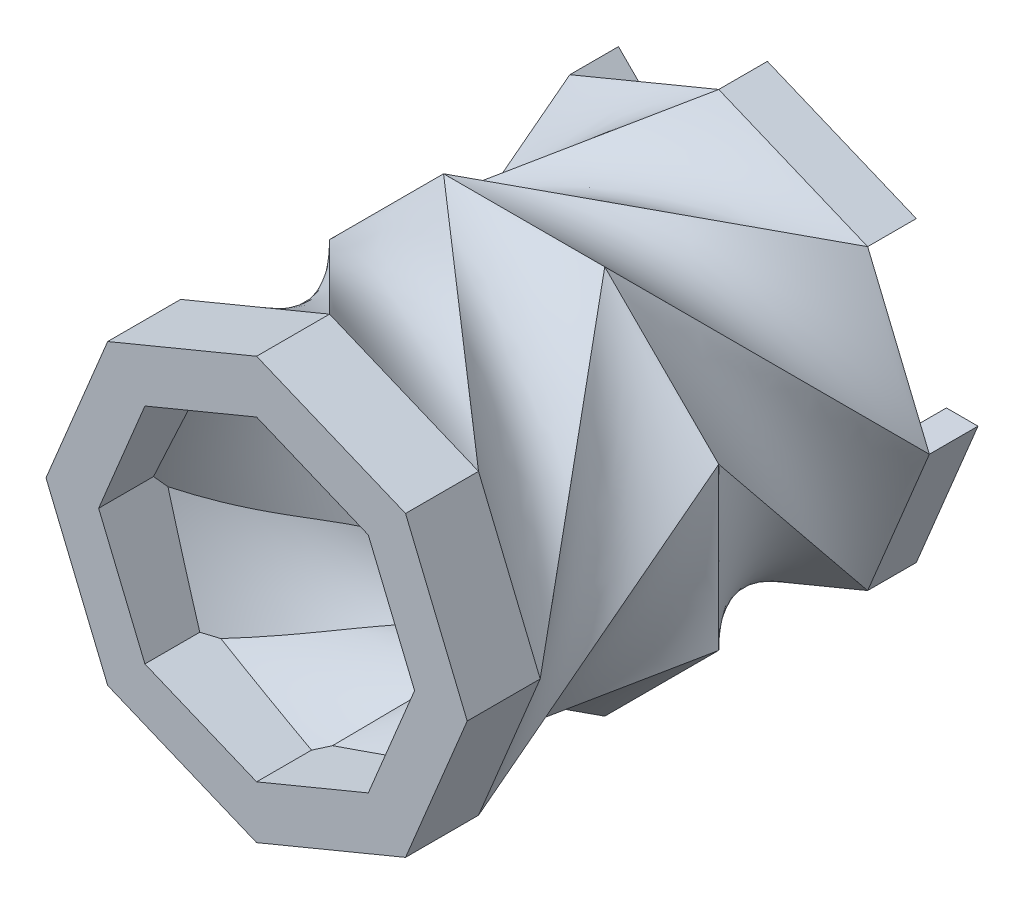
from build123d import *

# Parameters (mm, degrees)
SALIENTE_EXTRUIR1_DEPTH = 1.5
VACIADO2_T              = -1
CROQUIS8_R              = 0.679901254
CORTAR_EXTRUIR1_DEPTH   = 2.5
SALIENTE_EXTRUIR2_DEPTH = 1


with BuildPart() as part:
    # Recubrir3: read off the stored shape, not the designer's step
    # Recubrir3: loft between two sections, ruled curve by curve
    recubrir3_from = [
        Edge.make_bspline([(3.061467459, 3.061467459, 0), (2.551222882, 3.272817683, 0), (2.040978306, 3.484167906, 0), (1.020489153, 3.906868354, 0), (0.510244576, 4.118218577, 0), (0, 4.329568801, 0)], [0, 0, 0, 0, 0.5, 0.5, 1, 1, 1, 1], 3),
        Edge.make_bspline([(0, 4.329568801, 0), (-0.510244576, 4.118218577, 0), (-1.020489153, 3.906868354, 0), (-2.040978306, 3.484167906, 0), (-2.551222882, 3.272817683, 0), (-3.061467459, 3.061467459, 0)], [0, 0, 0, 0, 0.5, 0.5, 1, 1, 1, 1], 3),
        Edge.make_bspline([(4.329568801, 0, 0), (4.118218577, 0.510244576, 0), (3.906868354, 1.020489153, 0), (3.484167906, 2.040978306, 0), (3.272817683, 2.551222882, 0), (3.061467459, 3.061467459, 0)], [0, 0, 0, 0, 0.5, 0.5, 1, 1, 1, 1], 3),
        Edge.make_bspline([(-3.061467459, 3.061467459, 0), (-3.272817683, 2.551222882, 0), (-3.484167906, 2.040978306, 0), (-3.906868354, 1.020489153, 0), (-4.118218577, 0.510244576, 0), (-4.329568801, 0, 0)], [0, 0, 0, 0, 0.5, 0.5, 1, 1, 1, 1], 3),
        Edge.make_bspline([(-4.329568801, 0, 0), (-4.118218577, -0.510244576, 0), (-3.906868354, -1.020489153, 0), (-3.484167906, -2.040978306, 0), (-3.272817683, -2.551222882, 0), (-3.061467459, -3.061467459, 0)], [0, 0, 0, 0, 0.5, 0.5, 1, 1, 1, 1], 3),
        Edge.make_bspline([(-3.061467459, -3.061467459, 0), (-2.551222882, -3.272817683, 0), (-2.040978306, -3.484167906, 0), (-1.020489153, -3.906868354, 0), (-0.510244576, -4.118218577, 0), (0, -4.329568801, 0)], [0, 0, 0, 0, 0.5, 0.5, 1, 1, 1, 1], 3),
        Edge.make_bspline([(0, -4.329568801, 0), (0.510244576, -4.118218577, 0), (1.020489153, -3.906868354, 0), (2.040978306, -3.484167906, 0), (2.551222882, -3.272817683, 0), (3.061467459, -3.061467459, 0)], [0, 0, 0, 0, 0.5, 0.5, 1, 1, 1, 1], 3),
        Edge.make_bspline([(3.061467459, -3.061467459, 0), (3.272817683, -2.551222882, 0), (3.484167906, -2.040978306, 0), (3.906868354, -1.020489153, 0), (4.118218577, -0.510244576, 0), (4.329568801, 0, 0)], [0, 0, 0, 0, 0.5, 0.5, 1, 1, 1, 1], 3),
    ]
    recubrir3_to = [
        Edge.make_bspline([(-1.656854249, 4, 4), (-2.047378541, 3.609475708, 4), (-2.437902833, 3.218951416, 4), (-3.218951416, 2.437902833, 4), (-3.609475708, 2.047378541, 4), (-4, 1.656854249, 4)], [0, 0, 0, 0, 0.5, 0.5, 1, 1, 1, 1], 3),
        Edge.make_bspline([(-4, 1.656854249, 4), (-4, 1.1045695, 4), (-4, 0.55228475, 4), (-4, -0.55228475, 4), (-4, -1.1045695, 4), (-4, -1.656854249, 4)], [0, 0, 0, 0, 0.5, 0.5, 1, 1, 1, 1], 3),
        Edge.make_bspline([(1.656854249, 4, 4), (1.1045695, 4, 4), (0.55228475, 4, 4), (-0.55228475, 4, 4), (-1.1045695, 4, 4), (-1.656854249, 4, 4)], [0, 0, 0, 0, 0.5, 0.5, 1, 1, 1, 1], 3),
        Edge.make_bspline([(-4, -1.656854249, 4), (-3.609475708, -2.047378541, 4), (-3.218951416, -2.437902833, 4), (-2.437902833, -3.218951416, 4), (-2.047378541, -3.609475708, 4), (-1.656854249, -4, 4)], [0, 0, 0, 0, 0.5, 0.5, 1, 1, 1, 1], 3),
        Edge.make_bspline([(-1.656854249, -4, 4), (-1.1045695, -4, 4), (-0.55228475, -4, 4), (0.55228475, -4, 4), (1.1045695, -4, 4), (1.656854249, -4, 4)], [0, 0, 0, 0, 0.5, 0.5, 1, 1, 1, 1], 3),
        Edge.make_bspline([(1.656854249, -4, 4), (2.047378541, -3.609475708, 4), (2.437902833, -3.218951416, 4), (3.218951416, -2.437902833, 4), (3.609475708, -2.047378541, 4), (4, -1.656854249, 4)], [0, 0, 0, 0, 0.5, 0.5, 1, 1, 1, 1], 3),
        Edge.make_bspline([(4, -1.656854249, 4), (4, -1.1045695, 4), (4, -0.55228475, 4), (4, 0.55228475, 4), (4, 1.1045695, 4), (4, 1.656854249, 4)], [0, 0, 0, 0, 0.5, 0.5, 1, 1, 1, 1], 3),
        Edge.make_bspline([(4, 1.656854249, 4), (3.609475708, 2.047378541, 4), (3.218951416, 2.437902833, 4), (2.437902833, 3.218951416, 4), (2.047378541, 3.609475708, 4), (1.656854249, 4, 4)], [0, 0, 0, 0, 0.5, 0.5, 1, 1, 1, 1], 3),
    ]
    recubrir3 = Solid(Shell([*[Face.make_surface_from_curves(recubrir3_from[k], recubrir3_to[k]) for k in range(8)], Face(Wire(recubrir3_from)), Face(Wire(recubrir3_to))]))
    add(recubrir3)

    # Recubrir4: read off the stored shape, not the designer's step
    # Recubrir4: loft between two sections, ruled curve by curve
    recubrir4_from = [
        Edge.make_bspline([(4, -1.656854249, 4), (4, -1.1045695, 4), (4, -0.55228475, 4), (4, 0.55228475, 4), (4, 1.1045695, 4), (4, 1.656854249, 4)], [0, 0, 0, 0, 0.5, 0.5, 1, 1, 1, 1], 3),
        Edge.make_bspline([(4, 1.656854249, 4), (3.609475708, 2.047378541, 4), (3.218951416, 2.437902833, 4), (2.437902833, 3.218951416, 4), (2.047378541, 3.609475708, 4), (1.656854249, 4, 4)], [0, 0, 0, 0, 0.5, 0.5, 1, 1, 1, 1], 3),
        Edge.make_bspline([(1.656854249, -4, 4), (2.047378541, -3.609475708, 4), (2.437902833, -3.218951416, 4), (3.218951416, -2.437902833, 4), (3.609475708, -2.047378541, 4), (4, -1.656854249, 4)], [0, 0, 0, 0, 0.5, 0.5, 1, 1, 1, 1], 3),
        Edge.make_bspline([(1.656854249, 4, 4), (1.1045695, 4, 4), (0.55228475, 4, 4), (-0.55228475, 4, 4), (-1.1045695, 4, 4), (-1.656854249, 4, 4)], [0, 0, 0, 0, 0.5, 0.5, 1, 1, 1, 1], 3),
        Edge.make_bspline([(-1.656854249, 4, 4), (-2.047378541, 3.609475708, 4), (-2.437902833, 3.218951416, 4), (-3.218951416, 2.437902833, 4), (-3.609475708, 2.047378541, 4), (-4, 1.656854249, 4)], [0, 0, 0, 0, 0.5, 0.5, 1, 1, 1, 1], 3),
        Edge.make_bspline([(-4, 1.656854249, 4), (-4, 1.1045695, 4), (-4, 0.55228475, 4), (-4, -0.55228475, 4), (-4, -1.1045695, 4), (-4, -1.656854249, 4)], [0, 0, 0, 0, 0.5, 0.5, 1, 1, 1, 1], 3),
        Edge.make_bspline([(-4, -1.656854249, 4), (-3.609475708, -2.047378541, 4), (-3.218951416, -2.437902833, 4), (-2.437902833, -3.218951416, 4), (-2.047378541, -3.609475708, 4), (-1.656854249, -4, 4)], [0, 0, 0, 0, 0.5, 0.5, 1, 1, 1, 1], 3),
        Edge.make_bspline([(-1.656854249, -4, 4), (-1.1045695, -4, 4), (-0.55228475, -4, 4), (0.55228475, -4, 4), (1.1045695, -4, 4), (1.656854249, -4, 4)], [0, 0, 0, 0, 0.5, 0.5, 1, 1, 1, 1], 3),
    ]
    recubrir4_to = [
        Edge.make_bspline([(0, -4.329568801, 8), (0.510244576, -4.118218577, 8), (1.020489153, -3.906868354, 8), (2.040978306, -3.484167906, 8), (2.551222882, -3.272817683, 8), (3.061467459, -3.061467459, 8)], [0, 0, 0, 0, 0.5, 0.5, 1, 1, 1, 1], 3),
        Edge.make_bspline([(3.061467459, -3.061467459, 8), (3.272817683, -2.551222882, 8), (3.484167906, -2.040978306, 8), (3.906868354, -1.020489153, 8), (4.118218577, -0.510244576, 8), (4.329568801, 0, 8)], [0, 0, 0, 0, 0.5, 0.5, 1, 1, 1, 1], 3),
        Edge.make_bspline([(-3.061467459, -3.061467459, 8), (-2.551222882, -3.272817683, 8), (-2.040978306, -3.484167906, 8), (-1.020489153, -3.906868354, 8), (-0.510244576, -4.118218577, 8), (0, -4.329568801, 8)], [0, 0, 0, 0, 0.5, 0.5, 1, 1, 1, 1], 3),
        Edge.make_bspline([(4.329568801, 0, 8), (4.118218577, 0.510244576, 8), (3.906868354, 1.020489153, 8), (3.484167906, 2.040978306, 8), (3.272817683, 2.551222882, 8), (3.061467459, 3.061467459, 8)], [0, 0, 0, 0, 0.5, 0.5, 1, 1, 1, 1], 3),
        Edge.make_bspline([(3.061467459, 3.061467459, 8), (2.551222882, 3.272817683, 8), (2.040978306, 3.484167906, 8), (1.020489153, 3.906868354, 8), (0.510244576, 4.118218577, 8), (0, 4.329568801, 8)], [0, 0, 0, 0, 0.5, 0.5, 1, 1, 1, 1], 3),
        Edge.make_bspline([(0, 4.329568801, 8), (-0.510244576, 4.118218577, 8), (-1.020489153, 3.906868354, 8), (-2.040978306, 3.484167906, 8), (-2.551222882, 3.272817683, 8), (-3.061467459, 3.061467459, 8)], [0, 0, 0, 0, 0.5, 0.5, 1, 1, 1, 1], 3),
        Edge.make_bspline([(-3.061467459, 3.061467459, 8), (-3.272817683, 2.551222882, 8), (-3.484167906, 2.040978306, 8), (-3.906868354, 1.020489153, 8), (-4.118218577, 0.510244576, 8), (-4.329568801, 0, 8)], [0, 0, 0, 0, 0.5, 0.5, 1, 1, 1, 1], 3),
        Edge.make_bspline([(-4.329568801, 0, 8), (-4.118218577, -0.510244576, 8), (-3.906868354, -1.020489153, 8), (-3.484167906, -2.040978306, 8), (-3.272817683, -2.551222882, 8), (-3.061467459, -3.061467459, 8)], [0, 0, 0, 0, 0.5, 0.5, 1, 1, 1, 1], 3),
    ]
    recubrir4 = Solid(Shell([*[Face.make_surface_from_curves(recubrir4_from[k], recubrir4_to[k]) for k in range(8)], Face(Wire(recubrir4_from)), Face(Wire(recubrir4_to))]))
    add(recubrir4)

    # Croquis7 → Saliente-Extruir1 (add)
    with BuildSketch(Plane.XY.offset(8)):
        Polygon((4.329568801, 0), (3.061467459, 3.061467459), (0, 4.329568801), (-3.061467459, 3.061467459), (-4.329568801, 0), (-3.061467459, -3.061467459), (0, -4.329568801), (3.061467459, -3.061467459), align=None)
    extrude(amount=SALIENTE_EXTRUIR1_DEPTH)

    # Vaciado2
    vaciado2_openings = [part.faces().sort_by_distance(p)[0] for p in [
        (0, 0, 9.5),
    ]]
    offset(amount=VACIADO2_T, openings=vaciado2_openings)

    # Croquis8 → Cortar-Extruir1 (cut)
    with BuildSketch(Plane(origin=(0, 0, 0), x_dir=(-1, 0, 0), z_dir=(0, 0, -1))):
        Circle(CROQUIS8_R)
    extrude(amount=-CORTAR_EXTRUIR1_DEPTH, mode=Mode.SUBTRACT)

    # Croquis9 → Saliente-Extruir2 (add)
    with BuildSketch(Plane(origin=(0, 0, 0), x_dir=(-1, 0, 0), z_dir=(0, 0, -1))):
        Polygon((-3.061467459, 3.061467459), (0, 4.329568801), (0, 3.680133481), (-2.60224734, 2.60224734), align=None)
        Polygon((3.061467459, 3.061467459), (4.329568801, 0), (3.680133481, 0), (2.60224734, 2.60224734), align=None)
        Polygon((-4.329568801, 0), (-3.061467459, -3.061467459), (-2.60224734, -2.60224734), (-3.680133481, 0), align=None)
        Polygon((0, -4.329568801), (3.061467459, -3.061467459), (2.60224734, -2.60224734), (0, -3.680133481), align=None)
    extrude(amount=SALIENTE_EXTRUIR2_DEPTH)


solid = part.part
